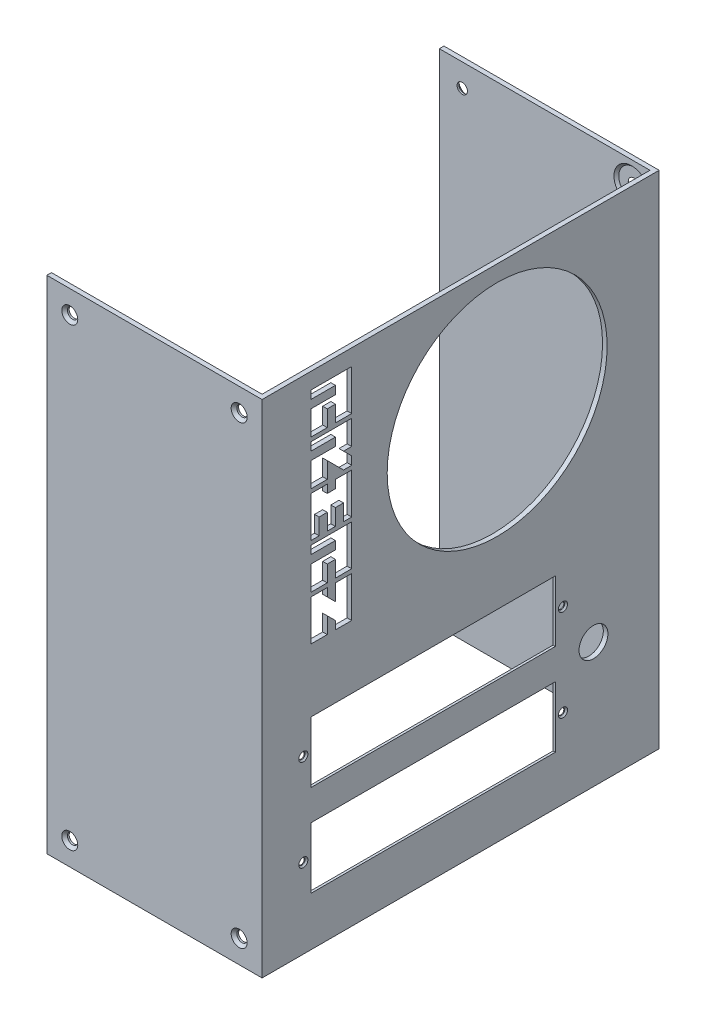
from build123d import *

# Parameters (mm, degrees)
SKETCH1_W                       = 165.076666628
SKETCH1_H                       = 208.28
BOSS_EXTRUDE1_DEPTH             = 89.481016872
SKETCH3_W                       = 161.266666628
SKETCH3_H                       = 208.28
CUT_EXTRUDE1_DEPTH              = 87.576016872
F_6_CLEARANCE_HOLE1_AT_2_COUNT  = 2
F_6_CLEARANCE_HOLE1_AT_2_PITCH  = 70.431016872
F_6_CLEARANCE_HOLE1_AT_3_COUNT  = 2
F_6_CLEARANCE_HOLE1_AT_3_PITCH  = 201.912161688
F_6_CLEARANCE_HOLE1_AT_4_COUNT  = 2
F_6_CLEARANCE_HOLE1_AT_4_PITCH  = 189.23
F_6_CLEARANCE_HOLE2_D           = 4.3053
F_6_CLEARANCE_HOLE2_DEPTH       = 6.858
F_6_CLEARANCE_HOLE2_CSINK_D     = 6.6548
F_6_CLEARANCE_HOLE2_CSINK_ANGLE = 90
F_6_CLEARANCE_HOLE2_TIP         = 1.293442612
CUT_EXTRUDE2_REACH              = 162.202
SKETCH8_R                       = 45.72
CUT_EXTRUDE3_REACH              = 162.202
SKETCH9_R                       = 6
SKETCH9_W                       = 101.6
SKETCH9_H                       = 25.4
CUT_EXTRUDE4_DEPTH              = 0.9525
CUT_EXTRUDE6_REACH              = 162.202
SKETCH13_R                      = 6.35
CUT_EXTRUDE7_DEPTH              = 1
CHAMFER1_SIZE                   = 1


# Read off the part's stored shape, not the designer's step: M2 Clearance Hole1
with BuildPart() as part:
    # Sketch1 → Boss-Extrude1 (new body)
    with BuildSketch(Plane(origin=(0, 0, 0), x_dir=(0, 0, -1), z_dir=(1, 0, 0))):
        Rectangle(SKETCH1_W, SKETCH1_H)
    extrude(amount=BOSS_EXTRUDE1_DEPTH)

    # Sketch3 → Cut-Extrude1 (cut)
    with BuildSketch(Plane.ZY):
        Rectangle(SKETCH3_W, SKETCH3_H)
    extrude(amount=-CUT_EXTRUDE1_DEPTH, mode=Mode.SUBTRACT)

    # Sketch5 → #6 Clearance Hole1 (revolve, cut)
    with BuildSketch(Plane(origin=(9.525, -94.615, -82.538333314), x_dir=(0, 1, 0), z_dir=(1, 0, 0))):
        Polygon((0, 0), (0, 1.905), (2.15265, 1.905), (2.15265, 1.17475), (3.3274, 0), align=None)
    f_6_clearance_hole1 = revolve(axis=Axis((9.525, -94.615, -88.888333314), (0, 0, 1)), mode=Mode.SUBTRACT)

    # #6 Clearance Hole1 at 2: #6 Clearance Hole1 ×2
    with Locations(*[(i * F_6_CLEARANCE_HOLE1_AT_2_PITCH, 0, 0) for i in range(1, F_6_CLEARANCE_HOLE1_AT_2_COUNT)]):
        add(f_6_clearance_hole1, mode=Mode.SUBTRACT)

    # #6 Clearance Hole1 at 3: #6 Clearance Hole1 ×2
    with Locations(*[Vector(0.34882008237197215, 0.9371897087217778, 0) * (i * F_6_CLEARANCE_HOLE1_AT_3_PITCH) for i in range(1, F_6_CLEARANCE_HOLE1_AT_3_COUNT)]):
        add(f_6_clearance_hole1, mode=Mode.SUBTRACT)

    # #6 Clearance Hole1 at 4: #6 Clearance Hole1 ×2
    with Locations(*[(0, i * F_6_CLEARANCE_HOLE1_AT_4_PITCH, 0) for i in range(1, F_6_CLEARANCE_HOLE1_AT_4_COUNT)]):
        add(f_6_clearance_hole1, mode=Mode.SUBTRACT)

    # #6 Clearance Hole2
    with Locations(Plane.XY.offset(82.538333314)):
        with Locations((9.525, 94.615), (79.956016872, 94.615), (79.956016872, -94.615), (9.525, -94.615)):
            CounterSinkHole(F_6_CLEARANCE_HOLE2_D / 2, F_6_CLEARANCE_HOLE2_CSINK_D / 2, depth=F_6_CLEARANCE_HOLE2_DEPTH, counter_sink_angle=F_6_CLEARANCE_HOLE2_CSINK_ANGLE)
            with Locations((0, 0, -(F_6_CLEARANCE_HOLE2_DEPTH + F_6_CLEARANCE_HOLE2_TIP / 2))):  # 118° drill point
                Cone(0, F_6_CLEARANCE_HOLE2_D / 2, F_6_CLEARANCE_HOLE2_TIP, mode=Mode.SUBTRACT)

    # Sketch8 → Cut-Extrude2 (cut, up to next)
    with BuildSketch(Plane(origin=(89.481016872, 0, 0), x_dir=(0, 0, -1), z_dir=(1, 0, 0)), mode=Mode.PRIVATE) as cut_extrude2_sk1:
        with Locations((15.193333225, 51.676666667)):
            Circle(SKETCH8_R)
    cut_extrude2_tool1 = extrude(cut_extrude2_sk1.sketch, amount=-CUT_EXTRUDE2_REACH, mode=Mode.PRIVATE) & part.part
    add(cut_extrude2_tool1.solids().sort_by_distance((89.481017, 51.676667, -15.193333))[0], mode=Mode.SUBTRACT)

    # Sketch9 → Cut-Extrude3 (cut, up to next)
    with BuildSketch(Plane(origin=(89.481016872, 0, 0), x_dir=(0, 0, -1), z_dir=(1, 0, 0)), mode=Mode.PRIVATE) as cut_extrude3_sk1:
        with Locations((55.233333314, -52.07)):
            Circle(SKETCH9_R)
    cut_extrude3_tool1 = extrude(cut_extrude3_sk1.sketch, amount=-CUT_EXTRUDE3_REACH, mode=Mode.PRIVATE) & part.part
    # Sketch9 → Cut-Extrude3 (cut, up to next)
    with BuildSketch(Plane(origin=(89.481016872, 0, 0), x_dir=(0, 0, -1), z_dir=(1, 0, 0)), mode=Mode.PRIVATE) as cut_extrude3_sk2:
        with Locations((-11.418333314, -33.02)):
            Rectangle(SKETCH9_W, SKETCH9_H)
    cut_extrude3_tool2 = extrude(cut_extrude3_sk2.sketch, amount=-CUT_EXTRUDE3_REACH, mode=Mode.PRIVATE) & part.part
    # Sketch9 → Cut-Extrude3 (cut, up to next)
    with BuildSketch(Plane(origin=(89.481016872, 0, 0), x_dir=(0, 0, -1), z_dir=(1, 0, 0)), mode=Mode.PRIVATE) as cut_extrude3_sk3:
        with Locations((-11.418333314, -71.12)):
            Rectangle(SKETCH9_W, SKETCH9_H)
    cut_extrude3_tool3 = extrude(cut_extrude3_sk3.sketch, amount=-CUT_EXTRUDE3_REACH, mode=Mode.PRIVATE) & part.part
    add(cut_extrude3_tool1.solids().sort_by_distance((89.481017, -52.07, -55.233333))[0], mode=Mode.SUBTRACT)
    add(cut_extrude3_tool2.solids().sort_by_distance((89.481017, -33.02, 11.418333))[0], mode=Mode.SUBTRACT)
    add(cut_extrude3_tool3.solids().sort_by_distance((89.481017, -71.12, 11.418333))[0], mode=Mode.SUBTRACT)

    # M2 Clearance Hole1 outline → M2 Clearance Hole1 (revolve, cut)
    with BuildSketch(Plane(origin=(0, -33.02, 65.393333314), x_dir=(0, 1, 0), z_dir=(0, 0, -1))):
        Polygon((0, 87.576016872), (1.3, 87.576016872), (1.3, 88.881016872), (1.9, 89.481016872), (0, 89.481016872), align=None)
    revolve(axis=Axis((0, -33.02, 65.393333314), (1, 0, 0)), mode=Mode.SUBTRACT)

    # M2 Clearance Hole1 2 outline → M2 Clearance Hole1 2 (revolve, cut)
    with BuildSketch(Plane(origin=(0, -33.02, -42.556666686), x_dir=(0, 1, 0), z_dir=(0, 0, -1))):
        Polygon((0, 87.576016872), (1.3, 87.576016872), (1.3, 88.881016872), (1.9, 89.481016872), (0, 89.481016872), align=None)
    revolve(axis=Axis((0, -33.02, -42.556666686), (1, 0, 0)), mode=Mode.SUBTRACT)

    # M2 Clearance Hole1 3 outline → M2 Clearance Hole1 3 (revolve, cut)
    with BuildSketch(Plane(origin=(0, -71.12, -42.556666686), x_dir=(0, 1, 0), z_dir=(0, 0, -1))):
        Polygon((0, 87.576016872), (1.3, 87.576016872), (1.3, 88.881016872), (1.9, 89.481016872), (0, 89.481016872), align=None)
    revolve(axis=Axis((0, -71.12, -42.556666686), (1, 0, 0)), mode=Mode.SUBTRACT)

    # M2 Clearance Hole1 4 outline → M2 Clearance Hole1 4 (revolve, cut)
    with BuildSketch(Plane(origin=(0, -71.12, 65.393333314), x_dir=(0, 1, 0), z_dir=(0, 0, -1))):
        Polygon((0, 87.576016872), (1.3, 87.576016872), (1.3, 88.881016872), (1.9, 89.481016872), (0, 89.481016872), align=None)
    revolve(axis=Axis((0, -71.12, 65.393333314), (1, 0, 0)), mode=Mode.SUBTRACT)

    # Sketch12 → Cut-Extrude4 (cut)
    with BuildSketch(Plane.ZY.offset(-87.576016872)):
        with BuildLine():
            Line((-39.381666686, -17.78), (62.218333314, -17.78))
            Line((62.218333314, -17.78), (66.304587615, -24.952694807))
            ThreePointArc((66.304587615, -24.952694807), (68.441333314, -33.02), (66.304587615, -41.087305193))
            Line((66.304587615, -41.087305193), (62.218333314, -48.26))
            Line((62.218333314, -48.26), (-39.381666686, -48.26))
            Line((-39.381666686, -48.26), (-43.467920986, -41.087305193))
            ThreePointArc((-43.467920986, -41.087305193), (-45.604666686, -33.02), (-43.467920986, -24.952694807))
            Line((-43.467920986, -24.952694807), (-39.381666686, -17.78))
        make_face()
        with BuildLine():
            Line((-43.467920986, -79.187305193), (-39.381666686, -86.36))
            Line((-39.381666686, -86.36), (62.218333314, -86.36))
            Line((62.218333314, -86.36), (66.304587615, -79.187305193))
            ThreePointArc((66.304587615, -79.187305193), (68.441333314, -71.12), (66.304587615, -63.052694807))
            Line((66.304587615, -63.052694807), (62.218333314, -55.88))
            Line((62.218333314, -55.88), (-39.381666686, -55.88))
            Line((-39.381666686, -55.88), (-43.467920986, -63.052694807))
            ThreePointArc((-43.467920986, -63.052694807), (-45.604666686, -71.12), (-43.467920986, -79.187305193))
        make_face()
    extrude(amount=-CUT_EXTRUDE4_DEPTH, mode=Mode.SUBTRACT)

    # Lettering Outline → Cut-Extrude6 (cut, up to next)
    with BuildSketch(Plane(origin=(89.481016872, 0, 0), x_dir=(0, 0, -1), z_dir=(1, 0, 0)), mode=Mode.PRIVATE) as cut_extrude6_sk1:
        Polygon((-62.218333314, 78.77), (-62.218333314, 75.383333333), (-52.058333314, 75.383333333), (-52.058333314, 71.996666667), (-62.218333314, 71.996666667), (-62.218333314, 61.836666667), (-55.444999981, 61.836666667), (-55.444999981, 68.61), (-48.671666648, 61.836666667), (-45.284999981, 61.836666667), (-45.284999981, 65.223333333), (-48.671666648, 68.61), (-45.284999981, 68.61), (-45.284999981, 78.77), align=None)
    cut_extrude6_tool1 = extrude(cut_extrude6_sk1.sketch, amount=-CUT_EXTRUDE6_REACH, mode=Mode.PRIVATE) & part.part
    # Lettering Outline → Cut-Extrude6 (cut, up to next)
    with BuildSketch(Plane(origin=(89.481016872, 0, 0), x_dir=(0, 0, -1), z_dir=(1, 0, 0)), mode=Mode.PRIVATE) as cut_extrude6_sk2:
        Polygon((-62.218333314, 80.463333333), (-62.218333314, 90.623333333), (-52.058333314, 90.623333333), (-52.058333314, 94.01), (-62.218333314, 94.01), (-62.218333314, 97.396666667), (-45.284999981, 97.396666667), (-45.284999981, 80.463333333), (-52.058333314, 80.463333333), (-52.058333314, 87.236666667), (-55.444999981, 87.236666667), (-55.444999981, 80.463333333), align=None)
    cut_extrude6_tool2 = extrude(cut_extrude6_sk2.sketch, amount=-CUT_EXTRUDE6_REACH, mode=Mode.PRIVATE) & part.part
    # Lettering Outline → Cut-Extrude6 (cut, up to next)
    with BuildSketch(Plane(origin=(89.481016872, 0, 0), x_dir=(0, 0, -1), z_dir=(1, 0, 0)), mode=Mode.PRIVATE) as cut_extrude6_sk3:
        Polygon((-62.218333314, 24.583333333), (-62.218333314, 34.743333333), (-52.058333314, 34.743333333), (-52.058333314, 38.13), (-62.218333314, 38.13), (-62.218333314, 41.516666667), (-45.284999981, 41.516666667), (-45.284999981, 24.583333333), (-52.058333314, 24.583333333), (-52.058333314, 31.356666667), (-55.444999981, 31.356666667), (-55.444999981, 24.583333333), align=None)
    cut_extrude6_tool3 = extrude(cut_extrude6_sk3.sketch, amount=-CUT_EXTRUDE6_REACH, mode=Mode.PRIVATE) & part.part
    # Lettering Outline → Cut-Extrude6 (cut, up to next)
    with BuildSketch(Plane(origin=(89.481016872, 0, 0), x_dir=(0, 0, -1), z_dir=(1, 0, 0)), mode=Mode.PRIVATE) as cut_extrude6_sk4:
        Polygon((-62.218333314, 5.956666667), (-62.218333314, 22.89), (-55.444999981, 22.89), (-55.444999981, 19.503333333), (-52.058333314, 16.116666667), (-52.058333314, 22.89), (-45.284999981, 22.89), (-45.284999981, 5.956666667), (-52.058333314, 5.956666667), (-52.058333314, 9.343333333), (-55.444999981, 12.73), (-55.444999981, 5.956666667), align=None)
    cut_extrude6_tool4 = extrude(cut_extrude6_sk4.sketch, amount=-CUT_EXTRUDE6_REACH, mode=Mode.PRIVATE) & part.part
    # Lettering Outline → Cut-Extrude6 (cut, up to next)
    with BuildSketch(Plane(origin=(89.481016872, 0, 0), x_dir=(0, 0, -1), z_dir=(1, 0, 0)), mode=Mode.PRIVATE) as cut_extrude6_sk5:
        Polygon((-62.218333314, 43.21), (-58.831666648, 43.21), (-58.831666648, 49.983333333), (-55.444999981, 49.983333333), (-55.444999981, 43.21), (-52.058333314, 43.21), (-52.058333314, 49.983333333), (-48.671666648, 49.983333333), (-48.671666648, 43.21), (-45.284999981, 43.21), (-45.284999981, 60.143333333), (-52.058333314, 60.143333333), (-52.058333314, 56.756666667), (-55.444999981, 56.756666667), (-55.444999981, 60.143333333), (-62.218333314, 60.143333333), align=None)
    cut_extrude6_tool5 = extrude(cut_extrude6_sk5.sketch, amount=-CUT_EXTRUDE6_REACH, mode=Mode.PRIVATE) & part.part
    add(cut_extrude6_tool1.solids().sort_by_distance((89.481017, 70.491481, 53.476681))[0], mode=Mode.SUBTRACT)
    add(cut_extrude6_tool2.solids().sort_by_distance((89.481017, 88.93, 53.243667))[0], mode=Mode.SUBTRACT)
    add(cut_extrude6_tool3.solids().sort_by_distance((89.481017, 33.05, 53.243667))[0], mode=Mode.SUBTRACT)
    add(cut_extrude6_tool4.solids().sort_by_distance((89.481017, 14.423333, 53.751667))[0], mode=Mode.SUBTRACT)
    add(cut_extrude6_tool5.solids().sort_by_distance((89.481017, 52.354, 53.751667))[0], mode=Mode.SUBTRACT)

    # Sketch13 → Cut-Extrude7 (cut)
    with BuildSketch(Plane.XY.offset(-80.633333314)):
        with Locations((79.956016872, 94.615)):
            Circle(SKETCH13_R)
    extrude(amount=-CUT_EXTRUDE7_DEPTH, mode=Mode.SUBTRACT)

    # Chamfer1
    chamfer1_edges = [part.edges().sort_by_distance(p)[0] for p in [
        (73.606016872, 94.615, -80.633333314),
    ]]
    chamfer(chamfer1_edges, length=CHAMFER1_SIZE - 0.0001)  # a hair under: the kernel refuses the full size


solid = part.part
